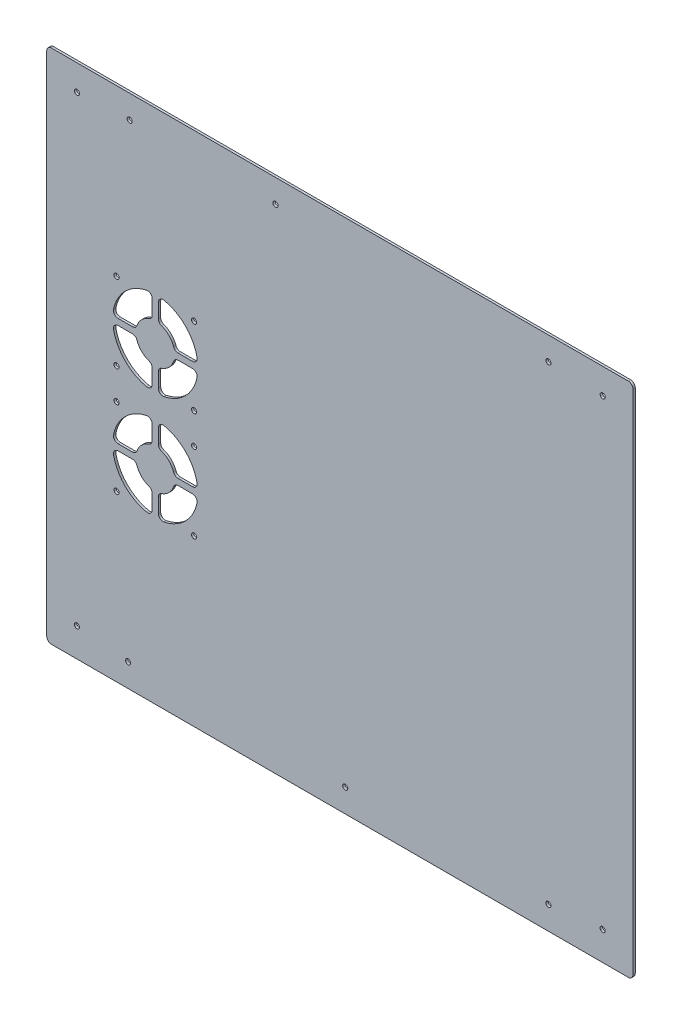
from build123d import *

# Parameters (mm, degrees)
CONVERT_SOLID1_START     = -1.5
CONVERT_SOLID1_OUTLINE_R = 1.65
CONVERT_SOLID1_DEPTH     = 1.5


# Read off the part's stored shape, not the designer's step: Convert-Solid1
with BuildPart() as part:
    # Convert-Solid1 outline → Convert-Solid1 (new body)
    with BuildSketch(Plane.XY.offset(CONVERT_SOLID1_START)):
        with BuildLine():
            Line((378, 3), (378, 330))
            ThreePointArc((378, 330), (377.121320344, 332.121320344), (375, 333))
            Line((375, 333), (3, 333))
            ThreePointArc((3, 333), (0.878679656, 332.121320344), (0, 330))
            Line((0, 330), (0, 3))
            ThreePointArc((0, 3), (0.878679656, 0.878679656), (3, 0))
            Line((3, 0), (375, 0))
            ThreePointArc((375, 0), (377.121320344, 0.878679656), (378, 3))
        make_face()
        with Locations((19.5, 18.5)):
            Circle(CONVERT_SOLID1_OUTLINE_R, mode=Mode.SUBTRACT)
        with Locations((52.5, 15)):
            Circle(CONVERT_SOLID1_OUTLINE_R, mode=Mode.SUBTRACT)
        with Locations((45, 106.5)):
            Circle(CONVERT_SOLID1_OUTLINE_R, mode=Mode.SUBTRACT)
        with BuildLine():
            ThreePointArc((65.967741935, 119.668225201), (67.439592774, 118.574562335), (68, 116.828599249))
            Line((68, 116.828599249), (68, 107.51563009))
            ThreePointArc((68, 107.51563009), (66.892520186, 105.187891413), (64.387755102, 104.578768468))
            ThreePointArc((64.387755102, 104.578768468), (50.554563517, 112.054563517), (43.078768468, 125.887755102))
            ThreePointArc((43.078768468, 125.887755102), (43.687891413, 128.392520186), (46.01563009, 129.5))
            Line((46.01563009, 129.5), (55.328599249, 129.5))
            ThreePointArc((55.328599249, 129.5), (57.074562335, 128.939592774), (58.168225201, 127.467741935))
            ThreePointArc((58.168225201, 127.467741935), (61.161165235, 122.661165235), (65.967741935, 119.668225201))
        make_face(mode=Mode.SUBTRACT)
        with BuildLine():
            ThreePointArc((81.831774799, 127.467741935), (82.925437665, 128.939592774), (84.671400751, 129.5))
            Line((84.671400751, 129.5), (93.98436991, 129.5))
            ThreePointArc((93.98436991, 129.5), (96.312108587, 128.392520186), (96.921231532, 125.887755102))
            ThreePointArc((96.921231532, 125.887755102), (89.445436483, 112.054563517), (75.612244898, 104.578768468))
            ThreePointArc((75.612244898, 104.578768468), (73.107479814, 105.187891413), (72, 107.51563009))
            Line((72, 107.51563009), (72, 116.828599249))
            ThreePointArc((72, 116.828599249), (72.560407226, 118.574562335), (74.032258065, 119.668225201))
            ThreePointArc((74.032258065, 119.668225201), (78.838834765, 122.661165235), (81.831774799, 127.467741935))
        make_face(mode=Mode.SUBTRACT)
        with Locations((45, 156.5)):
            Circle(CONVERT_SOLID1_OUTLINE_R, mode=Mode.SUBTRACT)
        with BuildLine():
            ThreePointArc((68, 146.171400751), (67.439592774, 144.425437665), (65.967741935, 143.331774799))
            ThreePointArc((65.967741935, 143.331774799), (61.161165235, 140.338834765), (58.168225201, 135.532258065))
            ThreePointArc((58.168225201, 135.532258065), (57.074562335, 134.060407226), (55.328599249, 133.5))
            Line((55.328599249, 133.5), (46.01563009, 133.5))
            ThreePointArc((46.01563009, 133.5), (43.687891413, 134.607479814), (43.078768468, 137.112244898))
            ThreePointArc((43.078768468, 137.112244898), (50.554563517, 150.945436483), (64.387755102, 158.421231532))
            ThreePointArc((64.387755102, 158.421231532), (66.892520186, 157.812108587), (68, 155.48436991))
            Line((68, 155.48436991), (68, 146.171400751))
        make_face(mode=Mode.SUBTRACT)
        with BuildLine():
            ThreePointArc((84.671400751, 133.5), (82.925437665, 134.060407226), (81.831774799, 135.532258065))
            ThreePointArc((81.831774799, 135.532258065), (78.838834765, 140.338834765), (74.032258065, 143.331774799))
            ThreePointArc((74.032258065, 143.331774799), (72.560407226, 144.425437665), (72, 146.171400751))
            Line((72, 146.171400751), (72, 155.48436991))
            ThreePointArc((72, 155.48436991), (73.107479814, 157.812108587), (75.612244898, 158.421231532))
            ThreePointArc((75.612244898, 158.421231532), (89.445436483, 150.945436483), (96.921231532, 137.112244898))
            ThreePointArc((96.921231532, 137.112244898), (96.312108587, 134.607479814), (93.98436991, 133.5))
            Line((93.98436991, 133.5), (84.671400751, 133.5))
        make_face(mode=Mode.SUBTRACT)
        with Locations((95, 106.5)):
            Circle(CONVERT_SOLID1_OUTLINE_R, mode=Mode.SUBTRACT)
        with Locations((95, 156.5)):
            Circle(CONVERT_SOLID1_OUTLINE_R, mode=Mode.SUBTRACT)
        with Locations((192.5, 15)):
            Circle(CONVERT_SOLID1_OUTLINE_R, mode=Mode.SUBTRACT)
        with Locations((323.5, 15)):
            Circle(CONVERT_SOLID1_OUTLINE_R, mode=Mode.SUBTRACT)
        with Locations((358.5, 18.5)):
            Circle(CONVERT_SOLID1_OUTLINE_R, mode=Mode.SUBTRACT)
        with Locations((45, 176.5)):
            Circle(CONVERT_SOLID1_OUTLINE_R, mode=Mode.SUBTRACT)
        with BuildLine():
            ThreePointArc((65.967741935, 189.668225201), (67.439592774, 188.574562335), (68, 186.828599249))
            Line((68, 186.828599249), (68, 177.51563009))
            ThreePointArc((68, 177.51563009), (66.892520186, 175.187891413), (64.387755102, 174.578768468))
            ThreePointArc((64.387755102, 174.578768468), (50.554563517, 182.054563517), (43.078768468, 195.887755102))
            ThreePointArc((43.078768468, 195.887755102), (43.687891413, 198.392520186), (46.01563009, 199.5))
            Line((46.01563009, 199.5), (55.328599249, 199.5))
            ThreePointArc((55.328599249, 199.5), (57.074562335, 198.939592774), (58.168225201, 197.467741935))
            ThreePointArc((58.168225201, 197.467741935), (61.161165235, 192.661165235), (65.967741935, 189.668225201))
        make_face(mode=Mode.SUBTRACT)
        with BuildLine():
            ThreePointArc((81.831774799, 197.467741935), (82.925437665, 198.939592774), (84.671400751, 199.5))
            Line((84.671400751, 199.5), (93.98436991, 199.5))
            ThreePointArc((93.98436991, 199.5), (96.312108587, 198.392520186), (96.921231532, 195.887755102))
            ThreePointArc((96.921231532, 195.887755102), (89.445436483, 182.054563517), (75.612244898, 174.578768468))
            ThreePointArc((75.612244898, 174.578768468), (73.107479814, 175.187891413), (72, 177.51563009))
            Line((72, 177.51563009), (72, 186.828599249))
            ThreePointArc((72, 186.828599249), (72.560407226, 188.574562335), (74.032258065, 189.668225201))
            ThreePointArc((74.032258065, 189.668225201), (78.838834765, 192.661165235), (81.831774799, 197.467741935))
        make_face(mode=Mode.SUBTRACT)
        with Locations((45, 226.5)):
            Circle(CONVERT_SOLID1_OUTLINE_R, mode=Mode.SUBTRACT)
        with BuildLine():
            ThreePointArc((68, 216.171400751), (67.439592774, 214.425437665), (65.967741935, 213.331774799))
            ThreePointArc((65.967741935, 213.331774799), (61.161165235, 210.338834765), (58.168225201, 205.532258065))
            ThreePointArc((58.168225201, 205.532258065), (57.074562335, 204.060407226), (55.328599249, 203.5))
            Line((55.328599249, 203.5), (46.01563009, 203.5))
            ThreePointArc((46.01563009, 203.5), (43.687891413, 204.607479814), (43.078768468, 207.112244898))
            ThreePointArc((43.078768468, 207.112244898), (50.554563517, 220.945436483), (64.387755102, 228.421231532))
            ThreePointArc((64.387755102, 228.421231532), (66.892520186, 227.812108587), (68, 225.48436991))
            Line((68, 225.48436991), (68, 216.171400751))
        make_face(mode=Mode.SUBTRACT)
        with BuildLine():
            ThreePointArc((84.671400751, 203.5), (82.925437665, 204.060407226), (81.831774799, 205.532258065))
            ThreePointArc((81.831774799, 205.532258065), (78.838834765, 210.338834765), (74.032258065, 213.331774799))
            ThreePointArc((74.032258065, 213.331774799), (72.560407226, 214.425437665), (72, 216.171400751))
            Line((72, 216.171400751), (72, 225.48436991))
            ThreePointArc((72, 225.48436991), (73.107479814, 227.812108587), (75.612244898, 228.421231532))
            ThreePointArc((75.612244898, 228.421231532), (89.445436483, 220.945436483), (96.921231532, 207.112244898))
            ThreePointArc((96.921231532, 207.112244898), (96.312108587, 204.607479814), (93.98436991, 203.5))
            Line((93.98436991, 203.5), (84.671400751, 203.5))
        make_face(mode=Mode.SUBTRACT)
        with Locations((95, 176.5)):
            Circle(CONVERT_SOLID1_OUTLINE_R, mode=Mode.SUBTRACT)
        with Locations((95, 226.5)):
            Circle(CONVERT_SOLID1_OUTLINE_R, mode=Mode.SUBTRACT)
        with Locations((19.5, 316.5)):
            Circle(CONVERT_SOLID1_OUTLINE_R, mode=Mode.SUBTRACT)
        with Locations((53.5, 318)):
            Circle(CONVERT_SOLID1_OUTLINE_R, mode=Mode.SUBTRACT)
        with Locations((147.5, 318)):
            Circle(CONVERT_SOLID1_OUTLINE_R, mode=Mode.SUBTRACT)
        with Locations((323.5, 318)):
            Circle(CONVERT_SOLID1_OUTLINE_R, mode=Mode.SUBTRACT)
        with Locations((358.5, 316.5)):
            Circle(CONVERT_SOLID1_OUTLINE_R, mode=Mode.SUBTRACT)
    extrude(amount=CONVERT_SOLID1_DEPTH)


solid = part.part
